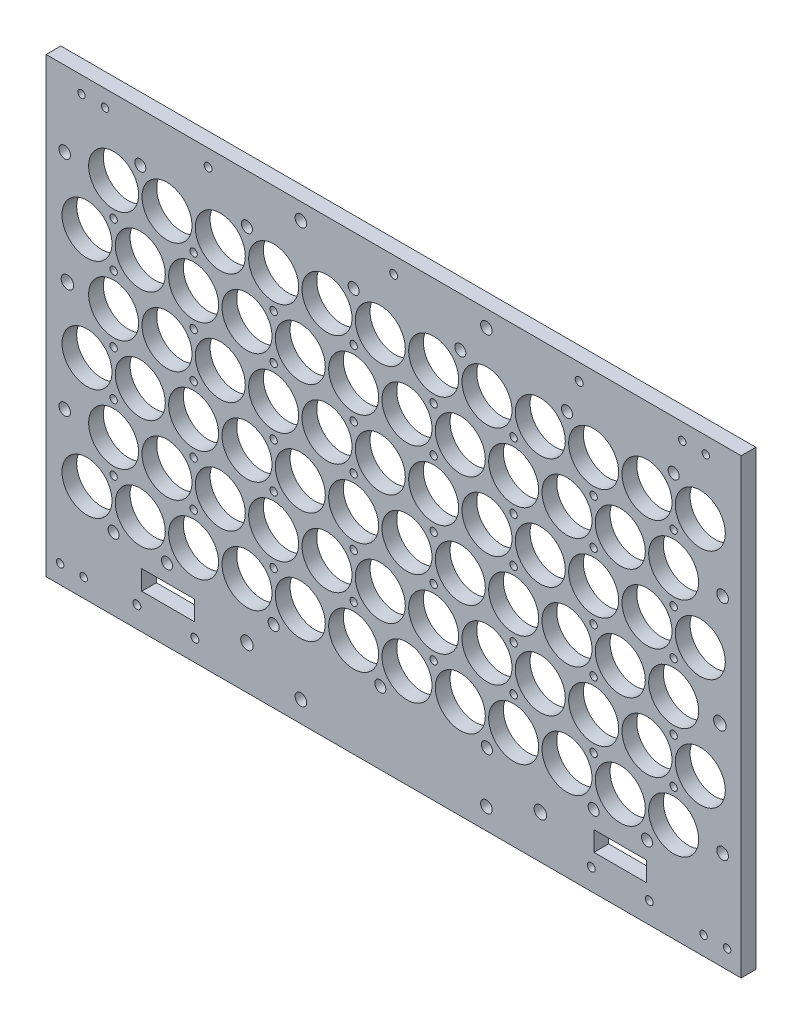
from build123d import *

# Parameters (mm, degrees)
SKETCH1_W                  = 299.700000132
SKETCH1_H                  = 194.250000104
BOSS_EXTRUDE1_DEPTH        = 6.35
CUT_EXTRUDE1_DEPTH         = 182.719853184
SKETCH4_R                  = 10.775
CUT_EXTRUDE2_DEPTH         = 182.719853184
LPATTERN1_COUNT            = 12
LPATTERN1_PITCH            = 23
LPATTERN2_COPY_1_DEPTH     = 182.719853184
LPATTERN2_COPY_2_DEPTH     = 182.719853184
LPATTERN2_COPY_3_DEPTH     = 182.719853184
LPATTERN2_COPY_4_DEPTH     = 182.719853184
LPATTERN2_COPY_5_DEPTH     = 182.719853184
LPATTERN2_COPY_6_DEPTH     = 182.719853184
LPATTERN2_COPY_7_DEPTH     = 182.719853184
LPATTERN2_COPY_8_DEPTH     = 182.719853184
LPATTERN2_COPY_9_DEPTH     = 182.719853184
LPATTERN2_COPY_10_DEPTH    = 182.719853184
LPATTERN2_COPY_11_DEPTH    = 182.719853184
LPATTERN2_COPY_12_DEPTH    = 182.719853184
LPATTERN2_COPY_13_DEPTH    = 182.719853184
LPATTERN2_COPY_14_DEPTH    = 182.719853184
LPATTERN2_COPY_15_DEPTH    = 182.719853184
LPATTERN2_COPY_16_DEPTH    = 182.719853184
LPATTERN2_COPY_17_DEPTH    = 182.719853184
LPATTERN2_COPY_18_DEPTH    = 182.719853184
LPATTERN2_COPY_19_DEPTH    = 182.719853184
LPATTERN2_COPY_20_DEPTH    = 182.719853184
LPATTERN2_COPY_21_DEPTH    = 182.719853184
LPATTERN2_COPY_22_DEPTH    = 182.719853184
LPATTERN2_COPY_23_SKETCH_R = 10.775
LPATTERN2_COPY_23_DEPTH    = 182.719853184
LPATTERN2_COPY_24_SKETCH_R = 10.775
LPATTERN2_COPY_24_DEPTH    = 182.719853184
LPATTERN2_COPY_25_SKETCH_R = 10.775
LPATTERN2_COPY_25_DEPTH    = 182.719853184
LPATTERN2_COPY_26_SKETCH_R = 10.775
LPATTERN2_COPY_26_DEPTH    = 182.719853184
LPATTERN2_COPY_27_SKETCH_R = 10.775
LPATTERN2_COPY_27_DEPTH    = 182.719853184
LPATTERN2_COPY_28_SKETCH_R = 10.775
LPATTERN2_COPY_28_DEPTH    = 182.719853184
LPATTERN2_COPY_29_SKETCH_R = 10.775
LPATTERN2_COPY_29_DEPTH    = 182.719853184
LPATTERN2_COPY_30_SKETCH_R = 10.775
LPATTERN2_COPY_30_DEPTH    = 182.719853184
LPATTERN2_COPY_31_SKETCH_R = 10.775
LPATTERN2_COPY_31_DEPTH    = 182.719853184
LPATTERN2_COPY_32_SKETCH_R = 10.775
LPATTERN2_COPY_32_DEPTH    = 182.719853184
LPATTERN2_COPY_33_SKETCH_R = 10.775
LPATTERN2_COPY_33_DEPTH    = 182.719853184
LPATTERN2_COPY_34_SKETCH_R = 10.775
LPATTERN2_COPY_34_DEPTH    = 182.719853184
LPATTERN2_COPY_35_SKETCH_R = 10.775
LPATTERN2_COPY_35_DEPTH    = 182.719853184
LPATTERN2_COPY_36_SKETCH_R = 10.775
LPATTERN2_COPY_36_DEPTH    = 182.719853184
LPATTERN2_COPY_37_SKETCH_R = 10.775
LPATTERN2_COPY_37_DEPTH    = 182.719853184
LPATTERN2_COPY_38_SKETCH_R = 10.775
LPATTERN2_COPY_38_DEPTH    = 182.719853184
LPATTERN2_COPY_39_SKETCH_R = 10.775
LPATTERN2_COPY_39_DEPTH    = 182.719853184
LPATTERN2_COPY_40_SKETCH_R = 10.775
LPATTERN2_COPY_40_DEPTH    = 182.719853184
LPATTERN2_COPY_41_SKETCH_R = 10.775
LPATTERN2_COPY_41_DEPTH    = 182.719853184
LPATTERN2_COPY_42_SKETCH_R = 10.775
LPATTERN2_COPY_42_DEPTH    = 182.719853184
LPATTERN2_COPY_43_SKETCH_R = 10.775
LPATTERN2_COPY_43_DEPTH    = 182.719853184
LPATTERN2_COPY_44_SKETCH_R = 10.775
LPATTERN2_COPY_44_DEPTH    = 182.719853184
LPATTERN2_COPY_45_DEPTH    = 182.719853184
LPATTERN2_COPY_46_DEPTH    = 182.719853184
LPATTERN2_COPY_47_SKETCH_R = 10.775
LPATTERN2_COPY_47_DEPTH    = 182.719853184
LPATTERN2_COPY_48_SKETCH_R = 10.775
LPATTERN2_COPY_48_DEPTH    = 182.719853184
SKETCH5_W                  = 22.76
SKETCH5_H                  = 8.4615
CUT_EXTRUDE3_DEPTH         = 182.719853184
M3_CLEARANCE_HOLE1_D       = 3.2
M3_CLEARANCE_HOLE2_D       = 3.4
SKETCH14_R                 = 2.7
CUT_EXTRUDE4_DEPTH         = 182.719853184
SKETCH15_R                 = 2.5
CUT_EXTRUDE5_DEPTH         = 182.719853184
SKETCH18_R                 = 2.38125
CUT_EXTRUDE7_DEPTH         = 182.719853184
SKETCH19_W                 = 299.700000132
SKETCH19_H                 = 6.35
BOSS_EXTRUDE2_DEPTH        = 0.79375
SKETCH22_R                 = 1.5875
CUT_EXTRUDE8_DEPTH         = 182.719853184
LPATTERN3_COUNT            = 3
LPATTERN3_PITCH            = 48
SKETCH23_R                 = 1.5875
CUT_EXTRUDE9_DEPTH         = 182.719853184
LPATTERN4_COUNT            = 2
LPATTERN4_PITCH            = 48
LPATTERN5_COUNT            = 4
LPATTERN5_PITCH            = 69
LPATTERN5_COPY_1_SKETCH_R  = 1.5875
LPATTERN5_COPY_1_DEPTH     = 182.719853184
LPATTERN5_COPY_2_SKETCH_R  = 1.5875
LPATTERN5_COPY_2_DEPTH     = 182.719853184
LPATTERN5_COPY_3_SKETCH_R  = 1.5875
LPATTERN5_COPY_3_DEPTH     = 182.719853184
LPATTERN5_COPY_4_SKETCH_R  = 1.5875
LPATTERN5_COPY_4_DEPTH     = 182.719853184
LPATTERN5_COPY_5_SKETCH_R  = 1.5875
LPATTERN5_COPY_5_DEPTH     = 182.719853184
LPATTERN5_COPY_6_SKETCH_R  = 1.5875
LPATTERN5_COPY_6_DEPTH     = 182.719853184
LPATTERN5_COPY_7_SKETCH_R  = 1.5875
LPATTERN5_COPY_7_DEPTH     = 182.719853184
LPATTERN5_COPY_8_SKETCH_R  = 1.5875
LPATTERN5_COPY_8_DEPTH     = 182.719853184
LPATTERN5_COPY_9_SKETCH_R  = 1.5875
LPATTERN5_COPY_9_DEPTH     = 182.719853184
M3_CLEARANCE_HOLE3_D       = 3.4


with BuildPart() as part:
    # Sketch1 → Boss-Extrude1 (new body)
    with BuildSketch(Plane.XY):
        with Locations((0, -5.475000052)):
            Rectangle(SKETCH1_W, SKETCH1_H)
    extrude(amount=BOSS_EXTRUDE1_DEPTH)

    # Sketch3 → Cut-Extrude1 (cut, through all)
    with BuildSketch(Plane.XY.offset(6.35)):
        with BuildLine():
            ThreePointArc((-121.475, -60), (-132.24999993, -49.225), (-143.025, -59.999999859))
            ThreePointArc((-143.025, -59.999999859), (-139.869075617, -67.619075517), (-132.25, -70.775))
            ThreePointArc((-132.25, -70.775), (-124.630924433, -67.619075567), (-121.475, -60))
        make_face()
    cut_extrude1 = extrude(amount=-CUT_EXTRUDE1_DEPTH, mode=Mode.SUBTRACT)

    # Sketch4 → Cut-Extrude2 (cut, through all)
    with BuildSketch(Plane.XY.offset(6.35)):
        with Locations((-120.75, -36)):
            Circle(SKETCH4_R)
    cut_extrude2 = extrude(amount=-CUT_EXTRUDE2_DEPTH, mode=Mode.SUBTRACT)

    # LPattern1: Cut-Extrude1, Cut-Extrude2 ×12
    with Locations(*[(i * LPATTERN1_PITCH, 0, 0) for i in range(1, LPATTERN1_COUNT)]):
        add(cut_extrude1, mode=Mode.SUBTRACT)
        add(cut_extrude2, mode=Mode.SUBTRACT)

    # LPattern2 copy 1 sketch → LPattern2 copy 1 (cut, through all)
    with BuildSketch(Plane(origin=(23, 48, 6.35), x_dir=(1, 0, 0), z_dir=(0, 0, 1))):
        with BuildLine():
            ThreePointArc((-121.475, -60), (-132.24999993, -49.225), (-143.025, -59.999999859))
            ThreePointArc((-143.025, -59.999999859), (-139.869075617, -67.619075517), (-132.25, -70.775))
            ThreePointArc((-132.25, -70.775), (-124.630924433, -67.619075567), (-121.475, -60))
        make_face()
    extrude(amount=-LPATTERN2_COPY_1_DEPTH, mode=Mode.SUBTRACT)

    # LPattern2 copy 2 sketch → LPattern2 copy 2 (cut, through all)
    with BuildSketch(Plane(origin=(23, 96, 6.35), x_dir=(1, 0, 0), z_dir=(0, 0, 1))):
        with BuildLine():
            ThreePointArc((-121.475, -60), (-132.24999993, -49.225), (-143.025, -59.999999859))
            ThreePointArc((-143.025, -59.999999859), (-139.869075617, -67.619075517), (-132.25, -70.775))
            ThreePointArc((-132.25, -70.775), (-124.630924433, -67.619075567), (-121.475, -60))
        make_face()
    extrude(amount=-LPATTERN2_COPY_2_DEPTH, mode=Mode.SUBTRACT)

    # LPattern2 copy 3 sketch → LPattern2 copy 3 (cut, through all)
    with BuildSketch(Plane(origin=(46, 48, 6.35), x_dir=(1, 0, 0), z_dir=(0, 0, 1))):
        with BuildLine():
            ThreePointArc((-121.475, -60), (-132.24999993, -49.225), (-143.025, -59.999999859))
            ThreePointArc((-143.025, -59.999999859), (-139.869075617, -67.619075517), (-132.25, -70.775))
            ThreePointArc((-132.25, -70.775), (-124.630924433, -67.619075567), (-121.475, -60))
        make_face()
    extrude(amount=-LPATTERN2_COPY_3_DEPTH, mode=Mode.SUBTRACT)

    # LPattern2 copy 4 sketch → LPattern2 copy 4 (cut, through all)
    with BuildSketch(Plane(origin=(46, 96, 6.35), x_dir=(1, 0, 0), z_dir=(0, 0, 1))):
        with BuildLine():
            ThreePointArc((-121.475, -60), (-132.24999993, -49.225), (-143.025, -59.999999859))
            ThreePointArc((-143.025, -59.999999859), (-139.869075617, -67.619075517), (-132.25, -70.775))
            ThreePointArc((-132.25, -70.775), (-124.630924433, -67.619075567), (-121.475, -60))
        make_face()
    extrude(amount=-LPATTERN2_COPY_4_DEPTH, mode=Mode.SUBTRACT)

    # LPattern2 copy 5 sketch → LPattern2 copy 5 (cut, through all)
    with BuildSketch(Plane(origin=(69, 48, 6.35), x_dir=(1, 0, 0), z_dir=(0, 0, 1))):
        with BuildLine():
            ThreePointArc((-121.475, -60), (-132.24999993, -49.225), (-143.025, -59.999999859))
            ThreePointArc((-143.025, -59.999999859), (-139.869075617, -67.619075517), (-132.25, -70.775))
            ThreePointArc((-132.25, -70.775), (-124.630924433, -67.619075567), (-121.475, -60))
        make_face()
    extrude(amount=-LPATTERN2_COPY_5_DEPTH, mode=Mode.SUBTRACT)

    # LPattern2 copy 6 sketch → LPattern2 copy 6 (cut, through all)
    with BuildSketch(Plane(origin=(69, 96, 6.35), x_dir=(1, 0, 0), z_dir=(0, 0, 1))):
        with BuildLine():
            ThreePointArc((-121.475, -60), (-132.24999993, -49.225), (-143.025, -59.999999859))
            ThreePointArc((-143.025, -59.999999859), (-139.869075617, -67.619075517), (-132.25, -70.775))
            ThreePointArc((-132.25, -70.775), (-124.630924433, -67.619075567), (-121.475, -60))
        make_face()
    extrude(amount=-LPATTERN2_COPY_6_DEPTH, mode=Mode.SUBTRACT)

    # LPattern2 copy 7 sketch → LPattern2 copy 7 (cut, through all)
    with BuildSketch(Plane(origin=(92, 48, 6.35), x_dir=(1, 0, 0), z_dir=(0, 0, 1))):
        with BuildLine():
            ThreePointArc((-121.475, -60), (-132.24999993, -49.225), (-143.025, -59.999999859))
            ThreePointArc((-143.025, -59.999999859), (-139.869075617, -67.619075517), (-132.25, -70.775))
            ThreePointArc((-132.25, -70.775), (-124.630924433, -67.619075567), (-121.475, -60))
        make_face()
    extrude(amount=-LPATTERN2_COPY_7_DEPTH, mode=Mode.SUBTRACT)

    # LPattern2 copy 8 sketch → LPattern2 copy 8 (cut, through all)
    with BuildSketch(Plane(origin=(92, 96, 6.35), x_dir=(1, 0, 0), z_dir=(0, 0, 1))):
        with BuildLine():
            ThreePointArc((-121.475, -60), (-132.24999993, -49.225), (-143.025, -59.999999859))
            ThreePointArc((-143.025, -59.999999859), (-139.869075617, -67.619075517), (-132.25, -70.775))
            ThreePointArc((-132.25, -70.775), (-124.630924433, -67.619075567), (-121.475, -60))
        make_face()
    extrude(amount=-LPATTERN2_COPY_8_DEPTH, mode=Mode.SUBTRACT)

    # LPattern2 copy 9 sketch → LPattern2 copy 9 (cut, through all)
    with BuildSketch(Plane(origin=(115, 48, 6.35), x_dir=(1, 0, 0), z_dir=(0, 0, 1))):
        with BuildLine():
            ThreePointArc((-121.475, -60), (-132.24999993, -49.225), (-143.025, -59.999999859))
            ThreePointArc((-143.025, -59.999999859), (-139.869075617, -67.619075517), (-132.25, -70.775))
            ThreePointArc((-132.25, -70.775), (-124.630924433, -67.619075567), (-121.475, -60))
        make_face()
    extrude(amount=-LPATTERN2_COPY_9_DEPTH, mode=Mode.SUBTRACT)

    # LPattern2 copy 10 sketch → LPattern2 copy 10 (cut, through all)
    with BuildSketch(Plane(origin=(115, 96, 6.35), x_dir=(1, 0, 0), z_dir=(0, 0, 1))):
        with BuildLine():
            ThreePointArc((-121.475, -60), (-132.24999993, -49.225), (-143.025, -59.999999859))
            ThreePointArc((-143.025, -59.999999859), (-139.869075617, -67.619075517), (-132.25, -70.775))
            ThreePointArc((-132.25, -70.775), (-124.630924433, -67.619075567), (-121.475, -60))
        make_face()
    extrude(amount=-LPATTERN2_COPY_10_DEPTH, mode=Mode.SUBTRACT)

    # LPattern2 copy 11 sketch → LPattern2 copy 11 (cut, through all)
    with BuildSketch(Plane(origin=(138, 48, 6.35), x_dir=(1, 0, 0), z_dir=(0, 0, 1))):
        with BuildLine():
            ThreePointArc((-121.475, -60), (-132.24999993, -49.225), (-143.025, -59.999999859))
            ThreePointArc((-143.025, -59.999999859), (-139.869075617, -67.619075517), (-132.25, -70.775))
            ThreePointArc((-132.25, -70.775), (-124.630924433, -67.619075567), (-121.475, -60))
        make_face()
    extrude(amount=-LPATTERN2_COPY_11_DEPTH, mode=Mode.SUBTRACT)

    # LPattern2 copy 12 sketch → LPattern2 copy 12 (cut, through all)
    with BuildSketch(Plane(origin=(138, 96, 6.35), x_dir=(1, 0, 0), z_dir=(0, 0, 1))):
        with BuildLine():
            ThreePointArc((-121.475, -60), (-132.24999993, -49.225), (-143.025, -59.999999859))
            ThreePointArc((-143.025, -59.999999859), (-139.869075617, -67.619075517), (-132.25, -70.775))
            ThreePointArc((-132.25, -70.775), (-124.630924433, -67.619075567), (-121.475, -60))
        make_face()
    extrude(amount=-LPATTERN2_COPY_12_DEPTH, mode=Mode.SUBTRACT)

    # LPattern2 copy 13 sketch → LPattern2 copy 13 (cut, through all)
    with BuildSketch(Plane(origin=(161, 48, 6.35), x_dir=(1, 0, 0), z_dir=(0, 0, 1))):
        with BuildLine():
            ThreePointArc((-121.475, -60), (-132.24999993, -49.225), (-143.025, -59.999999859))
            ThreePointArc((-143.025, -59.999999859), (-139.869075617, -67.619075517), (-132.25, -70.775))
            ThreePointArc((-132.25, -70.775), (-124.630924433, -67.619075567), (-121.475, -60))
        make_face()
    extrude(amount=-LPATTERN2_COPY_13_DEPTH, mode=Mode.SUBTRACT)

    # LPattern2 copy 14 sketch → LPattern2 copy 14 (cut, through all)
    with BuildSketch(Plane(origin=(161, 96, 6.35), x_dir=(1, 0, 0), z_dir=(0, 0, 1))):
        with BuildLine():
            ThreePointArc((-121.475, -60), (-132.24999993, -49.225), (-143.025, -59.999999859))
            ThreePointArc((-143.025, -59.999999859), (-139.869075617, -67.619075517), (-132.25, -70.775))
            ThreePointArc((-132.25, -70.775), (-124.630924433, -67.619075567), (-121.475, -60))
        make_face()
    extrude(amount=-LPATTERN2_COPY_14_DEPTH, mode=Mode.SUBTRACT)

    # LPattern2 copy 15 sketch → LPattern2 copy 15 (cut, through all)
    with BuildSketch(Plane(origin=(184, 48, 6.35), x_dir=(1, 0, 0), z_dir=(0, 0, 1))):
        with BuildLine():
            ThreePointArc((-121.475, -60), (-132.24999993, -49.225), (-143.025, -59.999999859))
            ThreePointArc((-143.025, -59.999999859), (-139.869075617, -67.619075517), (-132.25, -70.775))
            ThreePointArc((-132.25, -70.775), (-124.630924433, -67.619075567), (-121.475, -60))
        make_face()
    extrude(amount=-LPATTERN2_COPY_15_DEPTH, mode=Mode.SUBTRACT)

    # LPattern2 copy 16 sketch → LPattern2 copy 16 (cut, through all)
    with BuildSketch(Plane(origin=(184, 96, 6.35), x_dir=(1, 0, 0), z_dir=(0, 0, 1))):
        with BuildLine():
            ThreePointArc((-121.475, -60), (-132.24999993, -49.225), (-143.025, -59.999999859))
            ThreePointArc((-143.025, -59.999999859), (-139.869075617, -67.619075517), (-132.25, -70.775))
            ThreePointArc((-132.25, -70.775), (-124.630924433, -67.619075567), (-121.475, -60))
        make_face()
    extrude(amount=-LPATTERN2_COPY_16_DEPTH, mode=Mode.SUBTRACT)

    # LPattern2 copy 17 sketch → LPattern2 copy 17 (cut, through all)
    with BuildSketch(Plane(origin=(207, 48, 6.35), x_dir=(1, 0, 0), z_dir=(0, 0, 1))):
        with BuildLine():
            ThreePointArc((-121.475, -60), (-132.24999993, -49.225), (-143.025, -59.999999859))
            ThreePointArc((-143.025, -59.999999859), (-139.869075617, -67.619075517), (-132.25, -70.775))
            ThreePointArc((-132.25, -70.775), (-124.630924433, -67.619075567), (-121.475, -60))
        make_face()
    extrude(amount=-LPATTERN2_COPY_17_DEPTH, mode=Mode.SUBTRACT)

    # LPattern2 copy 18 sketch → LPattern2 copy 18 (cut, through all)
    with BuildSketch(Plane(origin=(207, 96, 6.35), x_dir=(1, 0, 0), z_dir=(0, 0, 1))):
        with BuildLine():
            ThreePointArc((-121.475, -60), (-132.24999993, -49.225), (-143.025, -59.999999859))
            ThreePointArc((-143.025, -59.999999859), (-139.869075617, -67.619075517), (-132.25, -70.775))
            ThreePointArc((-132.25, -70.775), (-124.630924433, -67.619075567), (-121.475, -60))
        make_face()
    extrude(amount=-LPATTERN2_COPY_18_DEPTH, mode=Mode.SUBTRACT)

    # LPattern2 copy 19 sketch → LPattern2 copy 19 (cut, through all)
    with BuildSketch(Plane(origin=(230, 48, 6.35), x_dir=(1, 0, 0), z_dir=(0, 0, 1))):
        with BuildLine():
            ThreePointArc((-121.475, -60), (-132.24999993, -49.225), (-143.025, -59.999999859))
            ThreePointArc((-143.025, -59.999999859), (-139.869075617, -67.619075517), (-132.25, -70.775))
            ThreePointArc((-132.25, -70.775), (-124.630924433, -67.619075567), (-121.475, -60))
        make_face()
    extrude(amount=-LPATTERN2_COPY_19_DEPTH, mode=Mode.SUBTRACT)

    # LPattern2 copy 20 sketch → LPattern2 copy 20 (cut, through all)
    with BuildSketch(Plane(origin=(230, 96, 6.35), x_dir=(1, 0, 0), z_dir=(0, 0, 1))):
        with BuildLine():
            ThreePointArc((-121.475, -60), (-132.24999993, -49.225), (-143.025, -59.999999859))
            ThreePointArc((-143.025, -59.999999859), (-139.869075617, -67.619075517), (-132.25, -70.775))
            ThreePointArc((-132.25, -70.775), (-124.630924433, -67.619075567), (-121.475, -60))
        make_face()
    extrude(amount=-LPATTERN2_COPY_20_DEPTH, mode=Mode.SUBTRACT)

    # LPattern2 copy 21 sketch → LPattern2 copy 21 (cut, through all)
    with BuildSketch(Plane(origin=(253, 48, 6.35), x_dir=(1, 0, 0), z_dir=(0, 0, 1))):
        with BuildLine():
            ThreePointArc((-121.475, -60), (-132.24999993, -49.225), (-143.025, -59.999999859))
            ThreePointArc((-143.025, -59.999999859), (-139.869075617, -67.619075517), (-132.25, -70.775))
            ThreePointArc((-132.25, -70.775), (-124.630924433, -67.619075567), (-121.475, -60))
        make_face()
    extrude(amount=-LPATTERN2_COPY_21_DEPTH, mode=Mode.SUBTRACT)

    # LPattern2 copy 22 sketch → LPattern2 copy 22 (cut, through all)
    with BuildSketch(Plane(origin=(253, 96, 6.35), x_dir=(1, 0, 0), z_dir=(0, 0, 1))):
        with BuildLine():
            ThreePointArc((-121.475, -60), (-132.24999993, -49.225), (-143.025, -59.999999859))
            ThreePointArc((-143.025, -59.999999859), (-139.869075617, -67.619075517), (-132.25, -70.775))
            ThreePointArc((-132.25, -70.775), (-124.630924433, -67.619075567), (-121.475, -60))
        make_face()
    extrude(amount=-LPATTERN2_COPY_22_DEPTH, mode=Mode.SUBTRACT)

    # LPattern2 copy 23 sketch → LPattern2 copy 23 (cut, through all)
    with BuildSketch(Plane(origin=(23, 48, 6.35), x_dir=(1, 0, 0), z_dir=(0, 0, 1))):
        with Locations((-120.75, -36)):
            Circle(LPATTERN2_COPY_23_SKETCH_R)
    extrude(amount=-LPATTERN2_COPY_23_DEPTH, mode=Mode.SUBTRACT)

    # LPattern2 copy 24 sketch → LPattern2 copy 24 (cut, through all)
    with BuildSketch(Plane(origin=(23, 96, 6.35), x_dir=(1, 0, 0), z_dir=(0, 0, 1))):
        with Locations((-120.75, -36)):
            Circle(LPATTERN2_COPY_24_SKETCH_R)
    extrude(amount=-LPATTERN2_COPY_24_DEPTH, mode=Mode.SUBTRACT)

    # LPattern2 copy 25 sketch → LPattern2 copy 25 (cut, through all)
    with BuildSketch(Plane(origin=(46, 48, 6.35), x_dir=(1, 0, 0), z_dir=(0, 0, 1))):
        with Locations((-120.75, -36)):
            Circle(LPATTERN2_COPY_25_SKETCH_R)
    extrude(amount=-LPATTERN2_COPY_25_DEPTH, mode=Mode.SUBTRACT)

    # LPattern2 copy 26 sketch → LPattern2 copy 26 (cut, through all)
    with BuildSketch(Plane(origin=(46, 96, 6.35), x_dir=(1, 0, 0), z_dir=(0, 0, 1))):
        with Locations((-120.75, -36)):
            Circle(LPATTERN2_COPY_26_SKETCH_R)
    extrude(amount=-LPATTERN2_COPY_26_DEPTH, mode=Mode.SUBTRACT)

    # LPattern2 copy 27 sketch → LPattern2 copy 27 (cut, through all)
    with BuildSketch(Plane(origin=(69, 48, 6.35), x_dir=(1, 0, 0), z_dir=(0, 0, 1))):
        with Locations((-120.75, -36)):
            Circle(LPATTERN2_COPY_27_SKETCH_R)
    extrude(amount=-LPATTERN2_COPY_27_DEPTH, mode=Mode.SUBTRACT)

    # LPattern2 copy 28 sketch → LPattern2 copy 28 (cut, through all)
    with BuildSketch(Plane(origin=(69, 96, 6.35), x_dir=(1, 0, 0), z_dir=(0, 0, 1))):
        with Locations((-120.75, -36)):
            Circle(LPATTERN2_COPY_28_SKETCH_R)
    extrude(amount=-LPATTERN2_COPY_28_DEPTH, mode=Mode.SUBTRACT)

    # LPattern2 copy 29 sketch → LPattern2 copy 29 (cut, through all)
    with BuildSketch(Plane(origin=(92, 48, 6.35), x_dir=(1, 0, 0), z_dir=(0, 0, 1))):
        with Locations((-120.75, -36)):
            Circle(LPATTERN2_COPY_29_SKETCH_R)
    extrude(amount=-LPATTERN2_COPY_29_DEPTH, mode=Mode.SUBTRACT)

    # LPattern2 copy 30 sketch → LPattern2 copy 30 (cut, through all)
    with BuildSketch(Plane(origin=(92, 96, 6.35), x_dir=(1, 0, 0), z_dir=(0, 0, 1))):
        with Locations((-120.75, -36)):
            Circle(LPATTERN2_COPY_30_SKETCH_R)
    extrude(amount=-LPATTERN2_COPY_30_DEPTH, mode=Mode.SUBTRACT)

    # LPattern2 copy 31 sketch → LPattern2 copy 31 (cut, through all)
    with BuildSketch(Plane(origin=(115, 48, 6.35), x_dir=(1, 0, 0), z_dir=(0, 0, 1))):
        with Locations((-120.75, -36)):
            Circle(LPATTERN2_COPY_31_SKETCH_R)
    extrude(amount=-LPATTERN2_COPY_31_DEPTH, mode=Mode.SUBTRACT)

    # LPattern2 copy 32 sketch → LPattern2 copy 32 (cut, through all)
    with BuildSketch(Plane(origin=(115, 96, 6.35), x_dir=(1, 0, 0), z_dir=(0, 0, 1))):
        with Locations((-120.75, -36)):
            Circle(LPATTERN2_COPY_32_SKETCH_R)
    extrude(amount=-LPATTERN2_COPY_32_DEPTH, mode=Mode.SUBTRACT)

    # LPattern2 copy 33 sketch → LPattern2 copy 33 (cut, through all)
    with BuildSketch(Plane(origin=(138, 48, 6.35), x_dir=(1, 0, 0), z_dir=(0, 0, 1))):
        with Locations((-120.75, -36)):
            Circle(LPATTERN2_COPY_33_SKETCH_R)
    extrude(amount=-LPATTERN2_COPY_33_DEPTH, mode=Mode.SUBTRACT)

    # LPattern2 copy 34 sketch → LPattern2 copy 34 (cut, through all)
    with BuildSketch(Plane(origin=(138, 96, 6.35), x_dir=(1, 0, 0), z_dir=(0, 0, 1))):
        with Locations((-120.75, -36)):
            Circle(LPATTERN2_COPY_34_SKETCH_R)
    extrude(amount=-LPATTERN2_COPY_34_DEPTH, mode=Mode.SUBTRACT)

    # LPattern2 copy 35 sketch → LPattern2 copy 35 (cut, through all)
    with BuildSketch(Plane(origin=(161, 48, 6.35), x_dir=(1, 0, 0), z_dir=(0, 0, 1))):
        with Locations((-120.75, -36)):
            Circle(LPATTERN2_COPY_35_SKETCH_R)
    extrude(amount=-LPATTERN2_COPY_35_DEPTH, mode=Mode.SUBTRACT)

    # LPattern2 copy 36 sketch → LPattern2 copy 36 (cut, through all)
    with BuildSketch(Plane(origin=(161, 96, 6.35), x_dir=(1, 0, 0), z_dir=(0, 0, 1))):
        with Locations((-120.75, -36)):
            Circle(LPATTERN2_COPY_36_SKETCH_R)
    extrude(amount=-LPATTERN2_COPY_36_DEPTH, mode=Mode.SUBTRACT)

    # LPattern2 copy 37 sketch → LPattern2 copy 37 (cut, through all)
    with BuildSketch(Plane(origin=(184, 48, 6.35), x_dir=(1, 0, 0), z_dir=(0, 0, 1))):
        with Locations((-120.75, -36)):
            Circle(LPATTERN2_COPY_37_SKETCH_R)
    extrude(amount=-LPATTERN2_COPY_37_DEPTH, mode=Mode.SUBTRACT)

    # LPattern2 copy 38 sketch → LPattern2 copy 38 (cut, through all)
    with BuildSketch(Plane(origin=(184, 96, 6.35), x_dir=(1, 0, 0), z_dir=(0, 0, 1))):
        with Locations((-120.75, -36)):
            Circle(LPATTERN2_COPY_38_SKETCH_R)
    extrude(amount=-LPATTERN2_COPY_38_DEPTH, mode=Mode.SUBTRACT)

    # LPattern2 copy 39 sketch → LPattern2 copy 39 (cut, through all)
    with BuildSketch(Plane(origin=(207, 48, 6.35), x_dir=(1, 0, 0), z_dir=(0, 0, 1))):
        with Locations((-120.75, -36)):
            Circle(LPATTERN2_COPY_39_SKETCH_R)
    extrude(amount=-LPATTERN2_COPY_39_DEPTH, mode=Mode.SUBTRACT)

    # LPattern2 copy 40 sketch → LPattern2 copy 40 (cut, through all)
    with BuildSketch(Plane(origin=(207, 96, 6.35), x_dir=(1, 0, 0), z_dir=(0, 0, 1))):
        with Locations((-120.75, -36)):
            Circle(LPATTERN2_COPY_40_SKETCH_R)
    extrude(amount=-LPATTERN2_COPY_40_DEPTH, mode=Mode.SUBTRACT)

    # LPattern2 copy 41 sketch → LPattern2 copy 41 (cut, through all)
    with BuildSketch(Plane(origin=(230, 48, 6.35), x_dir=(1, 0, 0), z_dir=(0, 0, 1))):
        with Locations((-120.75, -36)):
            Circle(LPATTERN2_COPY_41_SKETCH_R)
    extrude(amount=-LPATTERN2_COPY_41_DEPTH, mode=Mode.SUBTRACT)

    # LPattern2 copy 42 sketch → LPattern2 copy 42 (cut, through all)
    with BuildSketch(Plane(origin=(230, 96, 6.35), x_dir=(1, 0, 0), z_dir=(0, 0, 1))):
        with Locations((-120.75, -36)):
            Circle(LPATTERN2_COPY_42_SKETCH_R)
    extrude(amount=-LPATTERN2_COPY_42_DEPTH, mode=Mode.SUBTRACT)

    # LPattern2 copy 43 sketch → LPattern2 copy 43 (cut, through all)
    with BuildSketch(Plane(origin=(253, 48, 6.35), x_dir=(1, 0, 0), z_dir=(0, 0, 1))):
        with Locations((-120.75, -36)):
            Circle(LPATTERN2_COPY_43_SKETCH_R)
    extrude(amount=-LPATTERN2_COPY_43_DEPTH, mode=Mode.SUBTRACT)

    # LPattern2 copy 44 sketch → LPattern2 copy 44 (cut, through all)
    with BuildSketch(Plane(origin=(253, 96, 6.35), x_dir=(1, 0, 0), z_dir=(0, 0, 1))):
        with Locations((-120.75, -36)):
            Circle(LPATTERN2_COPY_44_SKETCH_R)
    extrude(amount=-LPATTERN2_COPY_44_DEPTH, mode=Mode.SUBTRACT)

    # LPattern2 copy 45 sketch → LPattern2 copy 45 (cut, through all)
    with BuildSketch(Plane(origin=(0, 48, 6.35), x_dir=(1, 0, 0), z_dir=(0, 0, 1))):
        with BuildLine():
            ThreePointArc((-121.475, -60), (-132.24999993, -49.225), (-143.025, -59.999999859))
            ThreePointArc((-143.025, -59.999999859), (-139.869075617, -67.619075517), (-132.25, -70.775))
            ThreePointArc((-132.25, -70.775), (-124.630924433, -67.619075567), (-121.475, -60))
        make_face()
    extrude(amount=-LPATTERN2_COPY_45_DEPTH, mode=Mode.SUBTRACT)

    # LPattern2 copy 46 sketch → LPattern2 copy 46 (cut, through all)
    with BuildSketch(Plane(origin=(0, 96, 6.35), x_dir=(1, 0, 0), z_dir=(0, 0, 1))):
        with BuildLine():
            ThreePointArc((-121.475, -60), (-132.24999993, -49.225), (-143.025, -59.999999859))
            ThreePointArc((-143.025, -59.999999859), (-139.869075617, -67.619075517), (-132.25, -70.775))
            ThreePointArc((-132.25, -70.775), (-124.630924433, -67.619075567), (-121.475, -60))
        make_face()
    extrude(amount=-LPATTERN2_COPY_46_DEPTH, mode=Mode.SUBTRACT)

    # LPattern2 copy 47 sketch → LPattern2 copy 47 (cut, through all)
    with BuildSketch(Plane(origin=(0, 48, 6.35), x_dir=(1, 0, 0), z_dir=(0, 0, 1))):
        with Locations((-120.75, -36)):
            Circle(LPATTERN2_COPY_47_SKETCH_R)
    extrude(amount=-LPATTERN2_COPY_47_DEPTH, mode=Mode.SUBTRACT)

    # LPattern2 copy 48 sketch → LPattern2 copy 48 (cut, through all)
    with BuildSketch(Plane(origin=(0, 96, 6.35), x_dir=(1, 0, 0), z_dir=(0, 0, 1))):
        with Locations((-120.75, -36)):
            Circle(LPATTERN2_COPY_48_SKETCH_R)
    extrude(amount=-LPATTERN2_COPY_48_DEPTH, mode=Mode.SUBTRACT)

    # Sketch5 → Cut-Extrude3 (cut, through all)
    with BuildSketch(Plane.XY.offset(6.35)):
        with Locations((97.75, -83.18075)):
            Rectangle(SKETCH5_W, SKETCH5_H)
        with Locations((-97.288, -83.18075)):
            Rectangle(SKETCH5_W, SKETCH5_H)
    extrude(amount=-CUT_EXTRUDE3_DEPTH, mode=Mode.SUBTRACT)

    # M3 Clearance Hole1 (through all)
    with Locations(Plane.XY.offset(6.35)):
        with Locations((124.450000066, 85.3), (134.610000066, 85.3), (-124.450000066, 85.3), (-134.610000066, 85.3), (-143.817500066, -94.6000001), (-133.657500066, -94.6000001), (133.657500066, -94.6000001), (143.817500066, -94.6000001)):
            Hole(M3_CLEARANCE_HOLE1_D / 2)

    # M3 Clearance Hole2 (through all)
    with Locations(Plane.XY.offset(6.35)):
        with Locations((110.25, -93.50575), (85.25, -93.50575), (-80, 85.3), (0, 85.3), (80, 85.3)):
            Hole(M3_CLEARANCE_HOLE2_D / 2)

    # Sketch14 → Cut-Extrude4 (cut, through all)
    with BuildSketch(Plane.XY.offset(6.35)):
        with Locations((140.687500033, -12)):
            Circle(SKETCH14_R)
        with Locations((-140.687500033, 12)):
            Circle(SKETCH14_R)
        with Locations((63.25, -83.95)):
            Circle(SKETCH14_R)
        with Locations((-63.25, -83.95)):
            Circle(SKETCH14_R)
    extrude(amount=-CUT_EXTRUDE4_DEPTH, mode=Mode.SUBTRACT)

    # Sketch15 → Cut-Extrude5 (cut, through all)
    with BuildSketch(Plane.XY.offset(6.35)):
        with Locations((-40, 85.3)):
            Circle(SKETCH15_R)
        with Locations((40, 85.3)):
            Circle(SKETCH15_R)
        with Locations((141.850000066, 36)):
            Circle(SKETCH15_R)
        with Locations((141.850000066, -60)):
            Circle(SKETCH15_R)
        with Locations((-141.850000066, -36)):
            Circle(SKETCH15_R)
        with Locations((-141.850000066, 60)):
            Circle(SKETCH15_R)
        with Locations((-40, -93.50575)):
            Circle(SKETCH15_R)
        with Locations((40, -93.50575)):
            Circle(SKETCH15_R)
    extrude(amount=-CUT_EXTRUDE5_DEPTH, mode=Mode.SUBTRACT)

    # Sketch18 → Cut-Extrude7 (cut, through all)
    with BuildSketch(Plane.XY.offset(6.35)):
        with Locations((109.25, -71.41)):
            Circle(SKETCH18_R)
        with Locations((86.25, -71.41)):
            Circle(SKETCH18_R)
        with Locations((120.75, 71.41)):
            Circle(SKETCH18_R)
        with Locations((74.75, 71.41)):
            Circle(SKETCH18_R)
        with Locations((28.75, 71.41)):
            Circle(SKETCH18_R)
        with Locations((-17.25, 71.41)):
            Circle(SKETCH18_R)
        with Locations((-63.25, 71.41)):
            Circle(SKETCH18_R)
        with Locations((-109.25, 71.41)):
            Circle(SKETCH18_R)
        with Locations((40.25, -71.41)):
            Circle(SKETCH18_R)
        with Locations((-5.75, -71.41)):
            Circle(SKETCH18_R)
        with Locations((-51.75, -71.41)):
            Circle(SKETCH18_R)
        with Locations((-97.75, -71.41)):
            Circle(SKETCH18_R)
        with Locations((-120.75, -71.41)):
            Circle(SKETCH18_R)
    extrude(amount=-CUT_EXTRUDE7_DEPTH, mode=Mode.SUBTRACT)

    # Sketch19 → Boss-Extrude2 (add)
    with BuildSketch(Plane(origin=(0, 91.65, 0), x_dir=(1, 0, 0), z_dir=(0, 1, 0))):
        with Locations((0, -3.175)):
            Rectangle(SKETCH19_W, SKETCH19_H)
    extrude(amount=BOSS_EXTRUDE2_DEPTH)

    # Sketch22 → Cut-Extrude8 (cut, through all)
    with BuildSketch(Plane.XY.offset(6.35)):
        with Locations((120.75, -45.71706771)):
            Circle(SKETCH22_R)
        with Locations((86.25, -50.28293229)):
            Circle(SKETCH22_R)
    cut_extrude8 = extrude(amount=-CUT_EXTRUDE8_DEPTH, mode=Mode.SUBTRACT)

    # LPattern3: Cut-Extrude8 ×3
    with Locations(*[(0, i * LPATTERN3_PITCH, 0) for i in range(1, LPATTERN3_COUNT)]):
        add(cut_extrude8, mode=Mode.SUBTRACT)

    # Sketch23 → Cut-Extrude9 (cut, through all)
    with BuildSketch(Plane.XY.offset(6.35)):
        with Locations((120.75, -26.28293229)):
            Circle(SKETCH23_R)
        with Locations((86.25, -21.71706771)):
            Circle(SKETCH23_R)
    cut_extrude9 = extrude(amount=-CUT_EXTRUDE9_DEPTH, mode=Mode.SUBTRACT)

    # LPattern4: Cut-Extrude9 ×2
    with Locations(*[(0, i * LPATTERN4_PITCH, 0) for i in range(1, LPATTERN4_COUNT)]):
        add(cut_extrude9, mode=Mode.SUBTRACT)

    # LPattern5: Cut-Extrude8, Cut-Extrude9 ×4
    with Locations(*[(-i * LPATTERN5_PITCH, 0, 0) for i in range(1, LPATTERN5_COUNT)]):
        add(cut_extrude8, mode=Mode.SUBTRACT)
        add(cut_extrude9, mode=Mode.SUBTRACT)

    # LPattern5 copy 1 sketch → LPattern5 copy 1 (cut, through all)
    with BuildSketch(Plane(origin=(-69, 48, 6.35), x_dir=(1, 0, 0), z_dir=(0, 0, 1))):
        with Locations((120.75, -45.71706771)):
            Circle(LPATTERN5_COPY_1_SKETCH_R)
        with Locations((86.25, -50.28293229)):
            Circle(LPATTERN5_COPY_1_SKETCH_R)
    extrude(amount=-LPATTERN5_COPY_1_DEPTH, mode=Mode.SUBTRACT)

    # LPattern5 copy 2 sketch → LPattern5 copy 2 (cut, through all)
    with BuildSketch(Plane(origin=(-138, 48, 6.35), x_dir=(1, 0, 0), z_dir=(0, 0, 1))):
        with Locations((120.75, -45.71706771)):
            Circle(LPATTERN5_COPY_2_SKETCH_R)
        with Locations((86.25, -50.28293229)):
            Circle(LPATTERN5_COPY_2_SKETCH_R)
    extrude(amount=-LPATTERN5_COPY_2_DEPTH, mode=Mode.SUBTRACT)

    # LPattern5 copy 3 sketch → LPattern5 copy 3 (cut, through all)
    with BuildSketch(Plane(origin=(-207, 48, 6.35), x_dir=(1, 0, 0), z_dir=(0, 0, 1))):
        with Locations((120.75, -45.71706771)):
            Circle(LPATTERN5_COPY_3_SKETCH_R)
        with Locations((86.25, -50.28293229)):
            Circle(LPATTERN5_COPY_3_SKETCH_R)
    extrude(amount=-LPATTERN5_COPY_3_DEPTH, mode=Mode.SUBTRACT)

    # LPattern5 copy 4 sketch → LPattern5 copy 4 (cut, through all)
    with BuildSketch(Plane(origin=(-69, 96, 6.35), x_dir=(1, 0, 0), z_dir=(0, 0, 1))):
        with Locations((120.75, -45.71706771)):
            Circle(LPATTERN5_COPY_4_SKETCH_R)
        with Locations((86.25, -50.28293229)):
            Circle(LPATTERN5_COPY_4_SKETCH_R)
    extrude(amount=-LPATTERN5_COPY_4_DEPTH, mode=Mode.SUBTRACT)

    # LPattern5 copy 5 sketch → LPattern5 copy 5 (cut, through all)
    with BuildSketch(Plane(origin=(-138, 96, 6.35), x_dir=(1, 0, 0), z_dir=(0, 0, 1))):
        with Locations((120.75, -45.71706771)):
            Circle(LPATTERN5_COPY_5_SKETCH_R)
        with Locations((86.25, -50.28293229)):
            Circle(LPATTERN5_COPY_5_SKETCH_R)
    extrude(amount=-LPATTERN5_COPY_5_DEPTH, mode=Mode.SUBTRACT)

    # LPattern5 copy 6 sketch → LPattern5 copy 6 (cut, through all)
    with BuildSketch(Plane(origin=(-207, 96, 6.35), x_dir=(1, 0, 0), z_dir=(0, 0, 1))):
        with Locations((120.75, -45.71706771)):
            Circle(LPATTERN5_COPY_6_SKETCH_R)
        with Locations((86.25, -50.28293229)):
            Circle(LPATTERN5_COPY_6_SKETCH_R)
    extrude(amount=-LPATTERN5_COPY_6_DEPTH, mode=Mode.SUBTRACT)

    # LPattern5 copy 7 sketch → LPattern5 copy 7 (cut, through all)
    with BuildSketch(Plane(origin=(-69, 48, 6.35), x_dir=(1, 0, 0), z_dir=(0, 0, 1))):
        with Locations((120.75, -26.28293229)):
            Circle(LPATTERN5_COPY_7_SKETCH_R)
        with Locations((86.25, -21.71706771)):
            Circle(LPATTERN5_COPY_7_SKETCH_R)
    extrude(amount=-LPATTERN5_COPY_7_DEPTH, mode=Mode.SUBTRACT)

    # LPattern5 copy 8 sketch → LPattern5 copy 8 (cut, through all)
    with BuildSketch(Plane(origin=(-138, 48, 6.35), x_dir=(1, 0, 0), z_dir=(0, 0, 1))):
        with Locations((120.75, -26.28293229)):
            Circle(LPATTERN5_COPY_8_SKETCH_R)
        with Locations((86.25, -21.71706771)):
            Circle(LPATTERN5_COPY_8_SKETCH_R)
    extrude(amount=-LPATTERN5_COPY_8_DEPTH, mode=Mode.SUBTRACT)

    # LPattern5 copy 9 sketch → LPattern5 copy 9 (cut, through all)
    with BuildSketch(Plane(origin=(-207, 48, 6.35), x_dir=(1, 0, 0), z_dir=(0, 0, 1))):
        with Locations((120.75, -26.28293229)):
            Circle(LPATTERN5_COPY_9_SKETCH_R)
        with Locations((86.25, -21.71706771)):
            Circle(LPATTERN5_COPY_9_SKETCH_R)
    extrude(amount=-LPATTERN5_COPY_9_DEPTH, mode=Mode.SUBTRACT)

    # M3 Clearance Hole3 (through all)
    with Locations(Plane.XY.offset(6.35)):
        with Locations((-85.712000066, -93.485979104), (-110.712000066, -93.485979104)):
            Hole(M3_CLEARANCE_HOLE3_D / 2)


solid = part.part
